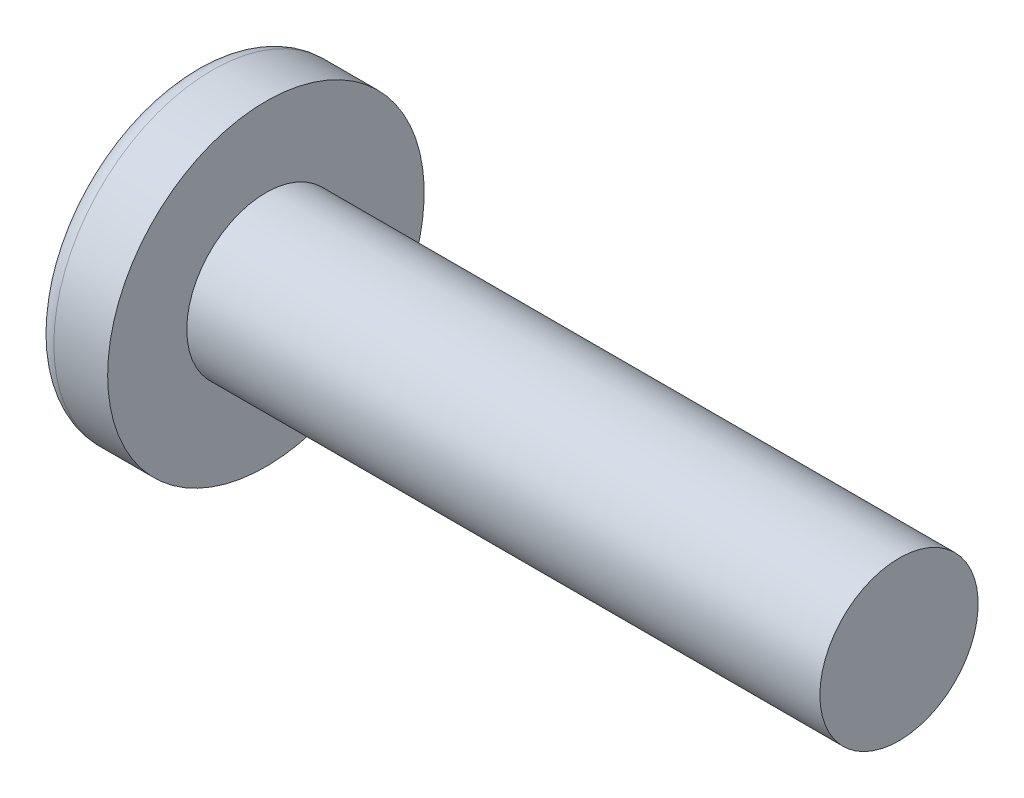
from build123d import *

# Parameters (mm, degrees)
CIRPATTERN1_COUNT = 2
CIRPATTERN1_ANGLE = 90


with BuildPart() as part:
    # BodySke → Base-Revolve (revolve)
    with BuildSketch(Plane.XY):
        with BuildLine():
            Line((7.5, 5), (7.5, 10))
            Line((7.5, 10), (4.100420175, 10))
            ThreePointArc((4.100420175, 10), (3.560149973, 9.871498067), (3.135589379, 9.513513514))
            ThreePointArc((3.135589379, 9.513513514), (0.804103022, 5.008464339), (0, 0))
            Line((0, 0), (47.5, 0))
            Line((47.5, 0), (47.5, 5))
            Line((47.5, 5), (7.5, 5))
        make_face()
    revolve(axis=Axis((-25.4, 0, 0), (1, 0, 0)))

    # Sketch3 → Cut-Loft1 section 0
    with BuildSketch(Plane(origin=(0, 0, 0), x_dir=(0, 0, -1), z_dir=(1, 0, 0))):
        with BuildLine():
            Line((0.92, -5.09), (-0.92, -5.09))
            Line((-0.92, -5.09), (-0.92, 5.09))
            Line((-0.92, 5.09), (0.92, 5.09))
            Line((0.92, 5.09), (0.92, -5.09))
        make_face()
    # Sketch4 → Cut-Loft1 section 1
    with BuildSketch(Plane(origin=(6.09, 0, 0), x_dir=(0, 0, -1), z_dir=(1, 0, 0))):
        with BuildLine():
            Line((0.46, -0.46), (-0.46, -0.46))
            Line((-0.46, -0.46), (-0.46, 0.46))
            Line((-0.46, 0.46), (0.46, 0.46))
            Line((0.46, 0.46), (0.46, -0.46))
        make_face()
    cut_loft1 = loft(mode=Mode.SUBTRACT)

    # CirPattern1: Cut-Loft1 ×2 about axis
    cirpattern1_axis = Axis((-25.4, 0, 0), (1, 0, 0))
    for i in range(1, CIRPATTERN1_COUNT):
        add(cut_loft1.rotate(cirpattern1_axis, i * CIRPATTERN1_ANGLE / (CIRPATTERN1_COUNT - 1)), mode=Mode.SUBTRACT)


solid = part.part
